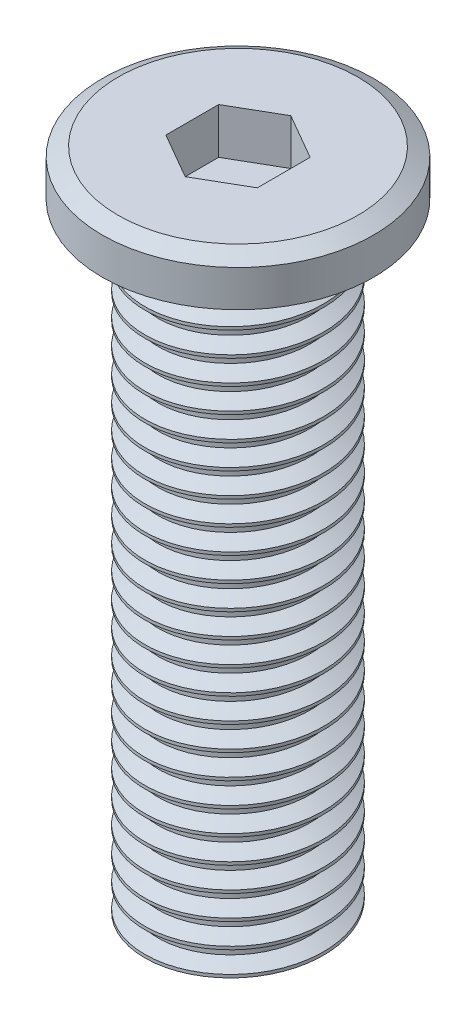
from build123d import *
from build123d.topology import SkipClean

# Parameters (mm, degrees)
SKETCH1_R           = 4.45
BOSS_EXTRUDE1_DEPTH = 1.5
CHAMFER2_SIZE       = 0.3
CHAMFER2_SIZE2      = 0.519615242
CUT_EXTRUDE1_DEPTH  = 3
SKETCH3_R           = 2.5
BOSS_EXTRUDE2_DEPTH = 20
THREAD1_PITCH       = 0.8


with BuildPart() as part:
    # Sketch1 → Boss-Extrude1 (new body)
    with BuildSketch(Plane(origin=(0, 0, 0), x_dir=(1, 0, 0), z_dir=(0, 1, 0))):
        with Locations(Location((0, 0, 0), (0, 0, 270))):
            Circle(SKETCH1_R)
    extrude(amount=BOSS_EXTRUDE1_DEPTH)

    # Chamfer2
    chamfer2_edges = [part.edges().sort_by_distance(p)[0] for p in [
        (0, 1.5, -4.45),
    ]]
    chamfer2_side = [part.faces().sort_by_distance(p)[0] for p in [
        (0, 0.75, -4.45),
    ]]
    chamfer(chamfer2_edges, length=CHAMFER2_SIZE, length2=CHAMFER2_SIZE2, reference=chamfer2_side[0])

    # Sketch8 → Cut-Extrude1 (cut)
    with BuildSketch(Plane(origin=(0, 1.5, 0), x_dir=(1, 0, 0), z_dir=(0, 1, 0))):
        Polygon((0, 1.732050808), (-1.5, 0.866025404), (-1.5, -0.866025404), (0, -1.732050808), (1.5, -0.866025404), (1.5, 0.866025404), align=None)
    extrude(amount=-CUT_EXTRUDE1_DEPTH, mode=Mode.SUBTRACT)

    # Sketch3 → Boss-Extrude2 (add)
    with BuildSketch(Plane.XZ):
        with Locations(Location((0, 0, 0), (0, 0, 90))):
            Circle(SKETCH3_R)
    extrude(amount=BOSS_EXTRUDE2_DEPTH)

    # Thread1: the profile of Thread Profile2 profile screwed along a right-hand helix of 25 turns, 8 arcs to a turn; built about Z, then put on its axis
    with SkipClean():  # the faces are left unmerged after this step: merging them gives an invalid solid
        thread1_z = Axis((0, 0, 0), (0, 0, 1))
        thread1_corners = [(2.4997, 0, -0.000173205), (2.9330127, 0, 0.249999999), (2.9330127, 0, 0.349999999), (2.4997, 0, 0.600173203)]
        with BuildLine(mode=Mode.PRIVATE) as thread1_profile:
            Line(thread1_corners[0], thread1_corners[1])
            Line(thread1_corners[1], thread1_corners[2])
            Line(thread1_corners[2], thread1_corners[3])
            Line(thread1_corners[3], thread1_corners[0])
        thread1_cap = Face(thread1_profile.wire())
        thread1_turn_angles = [0, 22.5, 45, 67.5, 90, 112.5, 135, 157.5, 180, 202.5, 225, 247.5, 270, 292.5, 315, 337.5, 360]
        thread1_turn_weights = [1, 0.9238795325112867, 1, 0.9238795325112867, 1, 0.9238795325112867, 1, 0.9238795325112867, 1, 0.9238795325112867, 1, 0.9238795325112867, 1, 0.9238795325112867, 1, 0.9238795325112867, 1]
        thread1_turn_rails = [Edge.make_bspline([Vector(p[0], p[1], 0).rotate(thread1_z, thread1_turn_angles[k]) / thread1_turn_weights[k] + Vector(0, 0, p[2] + THREAD1_PITCH * thread1_turn_angles[k] / 360) for k in range(17)], [0, 0, 0, 1, 1, 2, 2, 3, 3, 4, 4, 5, 5, 6, 6, 7, 7, 8, 8, 8], 2, thread1_turn_weights) for p in thread1_corners]
        thread1_turn_sides = [Face.make_surface_from_curves(thread1_turn_rails[p[0]], thread1_turn_rails[p[1]]) for p in [(0, 1), (1, 2), (2, 3), (3, 0)]]
        thread1 = Plane(origin=(0, 0, 0), x_dir=(-1, 0, 0), z_dir=(0, -1, 0)) * Solid(Shell([*[p.moved(Location((0, 0, THREAD1_PITCH * i))) for i in range(25) for p in thread1_turn_sides], thread1_cap, thread1_cap.rotate(thread1_z, 9000).moved(Location((0, 0, THREAD1_PITCH * 9000 / 360)))]))
        add(thread1)


solid = part.part
